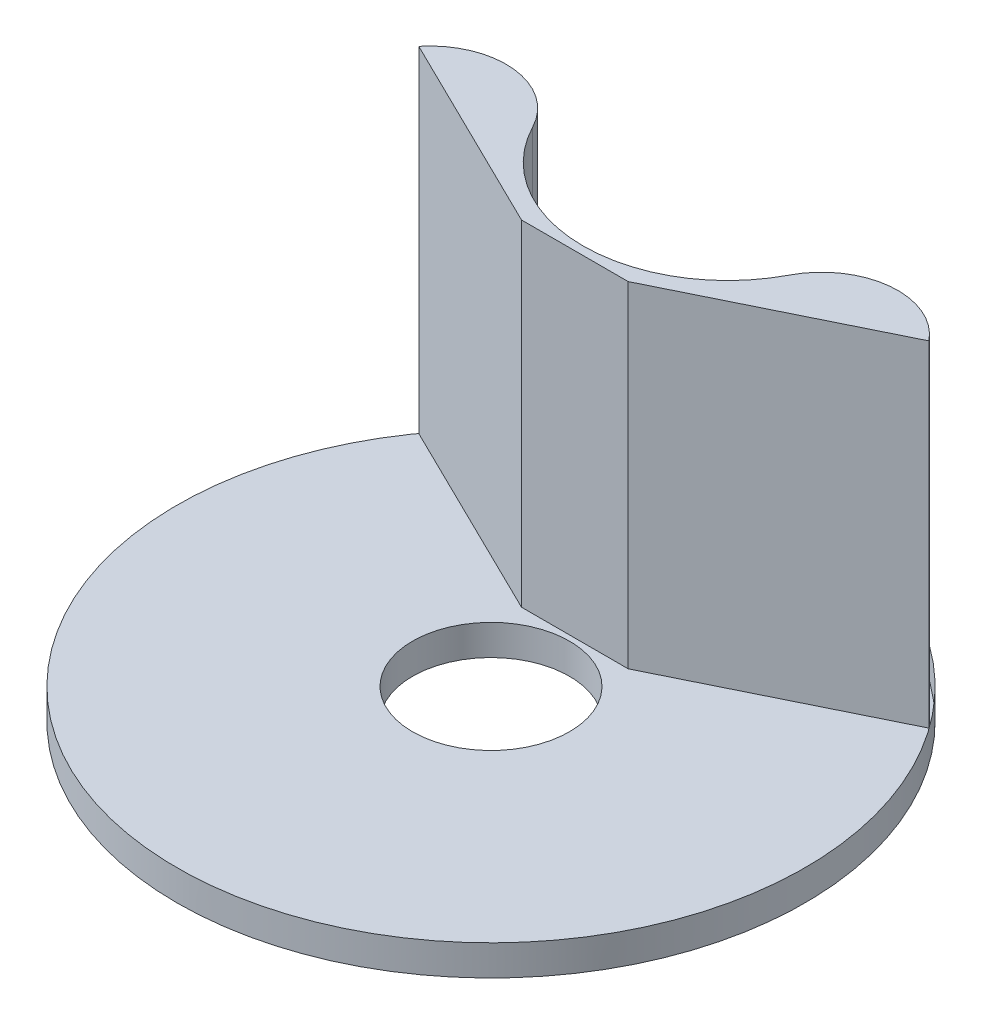
from build123d import *

# Parameters (mm, degrees)
SKETCH1_R           = 20.6
BOSS_EXTRUDE1_DEPTH = 2
SKETCH2_R           = 5.15
CUT_EXTRUDE1_DEPTH  = 3
SKETCH3_R           = 6.5
CUT_EXTRUDE2_DEPTH  = 2
BOSS_EXTRUDE4_DEPTH = 22
FILLET1_R           = 5


with BuildPart() as part:
    # Sketch1 → Boss-Extrude1 (new body)
    with BuildSketch(Plane(origin=(0, 0, 0), x_dir=(1, 0, 0), z_dir=(0, 1, 0))):
        with Locations(Location((0, 0, 0), (0, 0, 270))):
            Circle(SKETCH1_R)
    extrude(amount=BOSS_EXTRUDE1_DEPTH)

    # Sketch2 → Cut-Extrude1 (cut)
    with BuildSketch(Plane(origin=(0, 2, 0), x_dir=(1, 0, 0), z_dir=(0, 1, 0))):
        with Locations(Location((0, 0, 0), (0, 0, 270))):
            Circle(SKETCH2_R)
    extrude(amount=-CUT_EXTRUDE1_DEPTH, mode=Mode.SUBTRACT)

    # Sketch3 → Cut-Extrude2 (cut)
    with BuildSketch(Plane(origin=(0, 2, 0), x_dir=(1, 0, 0), z_dir=(0, 1, 0))):
        with Locations(Location((0, 13, 0), (0, 0, 270))):
            Circle(SKETCH3_R)
    extrude(amount=-CUT_EXTRUDE2_DEPTH, mode=Mode.SUBTRACT)

    # Sketch4 → Boss-Extrude4 (add)
    with BuildSketch(Plane(origin=(0, 2, 0), x_dir=(1, 0, 0), z_dir=(0, 1, 0))):
        with BuildLine():
            Line((-16.743954133, 12), (-3.5, 5.5))
            Line((-3.5, 5.5), (3.5, 5.5))
            Line((3.5, 5.5), (16.743954133, 12))
            ThreePointArc((16.743954133, 12), (13.279606143, 15.748398671), (9, 18.529975715))
            ThreePointArc((9, 18.529975715), (0, 6.042759079), (-9, 18.529975715))
            ThreePointArc((-9, 18.529975715), (-13.279606143, 15.748398671), (-16.743954133, 12))
        make_face()
    extrude(amount=BOSS_EXTRUDE4_DEPTH)

    # Fillet1
    # the kernel refuses this fillet: 5 mm, written as the material it takes off along each edge
    with BuildSketch(Plane(origin=(-9, 2, -18.529975715), x_dir=(-0.7582820448894503, 0, 0.6519266372823508), z_dir=(0, 1, 0))) as fillet1_piece_1:
        with BuildLine():
            CenterArc((9.235650387, 4.834535828), FILLET1_R, 166.800937992, 117.98025937)
            ThreePointArc((4.367737182, 5.976210486), (2.790781466, 2.544540557), (0, 0))
            ThreePointArc((0, 0), (5.255646353, -0.681712388), (10.511292706, 0))
        make_face()
    extrude(amount=48.278231764, mode=Mode.SUBTRACT)
    with BuildSketch(Plane(origin=(9, 2, -18.529975715), x_dir=(0.7582820448894505, 0, 0.6519266372823505), z_dir=(0, 1, 0))) as fillet1_piece_2:
        with BuildLine():
            CenterArc((9.235650387, -4.834535828), FILLET1_R, 75.218802639, 117.98025937)
            ThreePointArc((4.367737182, -5.976210486), (2.790781466, -2.544540557), (0, 0))
            ThreePointArc((0, 0), (5.255646353, 0.681712388), (10.511292706, 0))
        make_face()
    extrude(amount=48.278231764, mode=Mode.SUBTRACT)


solid = part.part
